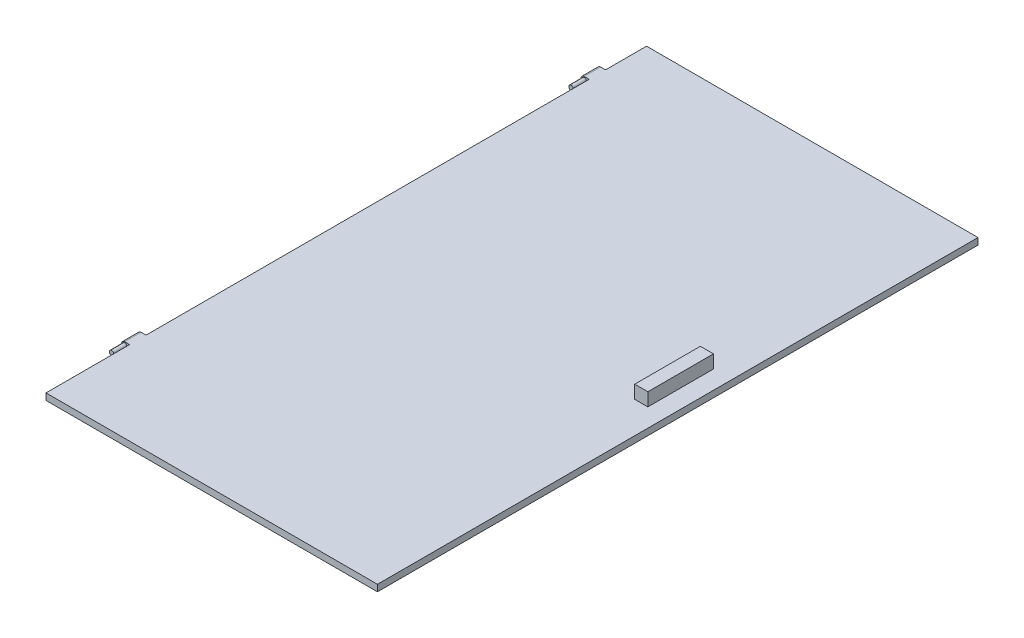
from build123d import *

# Parameters (mm, degrees)
SKETCH1_W           = 505
SKETCH1_H           = 915
BOSS_EXTRUDE1_DEPTH = 10
SKETCH2_W           = 25
SKETCH2_H           = 10
BOSS_EXTRUDE2_DEPTH = 12.5
SKETCH3_R           = 3.5
BOSS_EXTRUDE3_DEPTH = 20
LPATTERN1_COUNT     = 2
LPATTERN1_PITCH     = 700
FILLET1_R           = 5
SKETCH4_W           = 20
SKETCH4_H           = 100
BOSS_EXTRUDE4_DEPTH = 20


with BuildPart() as part:
    # Sketch1 → Boss-Extrude1 (new body)
    with BuildSketch(Plane(origin=(0, 0, 0), x_dir=(1, 0, 0), z_dir=(0, 1, 0))):
        with Locations((-7.5, -32.5)):
            Rectangle(SKETCH1_W, SKETCH1_H)
    extrude(amount=BOSS_EXTRUDE1_DEPTH)

    # Sketch2 → Boss-Extrude2 (add)
    with BuildSketch(Plane.ZY.offset(260)):
        with Locations((-350, 5)):
            Rectangle(SKETCH2_W, SKETCH2_H)
        with Locations((350, 5)):
            Rectangle(SKETCH2_W, SKETCH2_H)
    extrude(amount=BOSS_EXTRUDE2_DEPTH)

    # Sketch3 → Boss-Extrude3 (add)
    with BuildSketch(Plane.XY.offset(-337.5)):
        with Locations(Location((-267.5, 5, 0), (0, 0, 180))):
            Circle(SKETCH3_R)
    boss_extrude3 = extrude(amount=BOSS_EXTRUDE3_DEPTH)

    # LPattern1: Boss-Extrude3 ×2
    with Locations(*[(0, 0, i * LPATTERN1_PITCH) for i in range(1, LPATTERN1_COUNT)]):
        add(boss_extrude3)

    # Fillet1
    fillet1_edges = [part.edges().sort_by_distance(p)[0] for p in [
        (-272.5, 0, 350),
        (-272.5, 10, 350),
        (-272.5, 0, -350),
        (-272.5, 10, -350),
    ]]
    fillet(fillet1_edges, radius=FILLET1_R - 0.0001)  # a hair under: the kernel refuses the full size

    # Sketch4 → Boss-Extrude4 (add)
    with BuildSketch(Plane(origin=(0, 10, 0), x_dir=(1, 0, 0), z_dir=(0, 1, 0))):
        with Locations((206.961175434, 0)):
            Rectangle(SKETCH4_W, SKETCH4_H)
    extrude(amount=BOSS_EXTRUDE4_DEPTH)


solid = part.part
